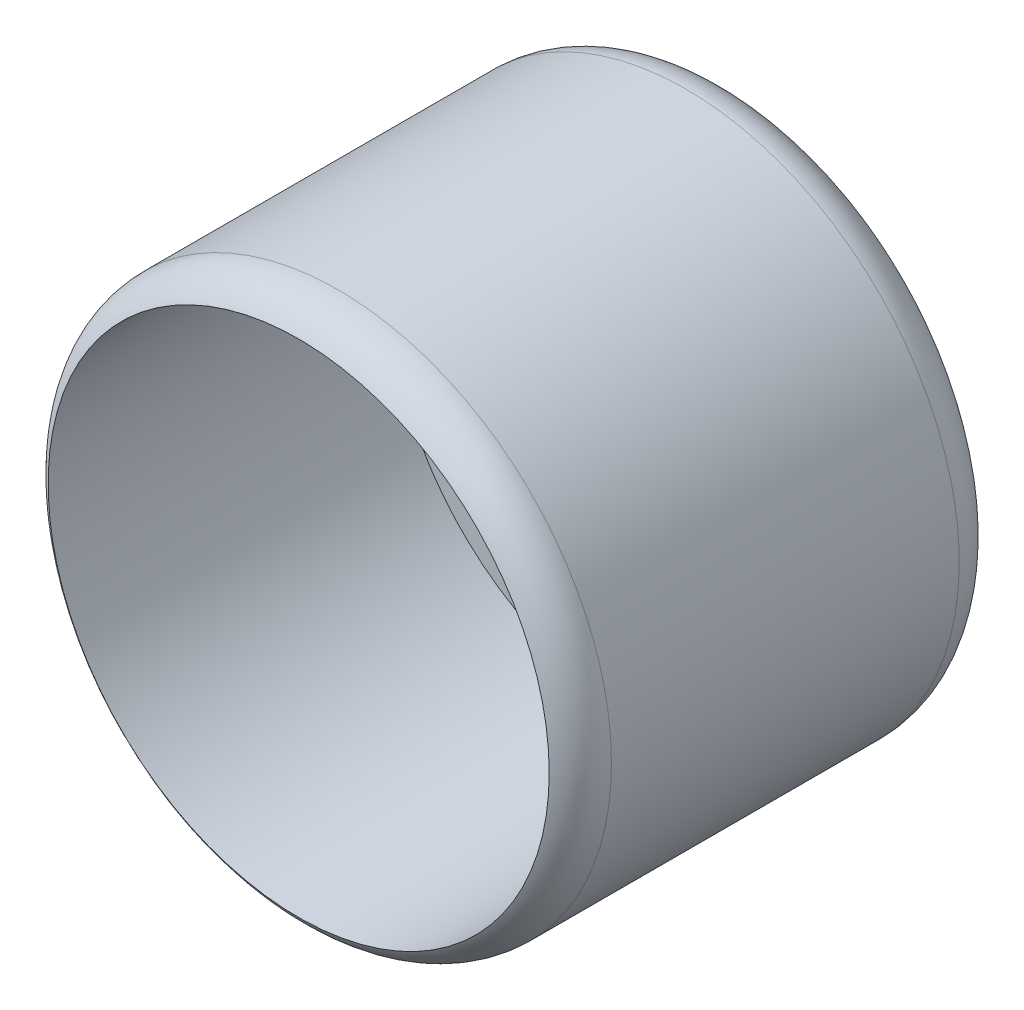
from build123d import *

# Parameters (mm, degrees)
BOSS_EXTRU_1_START      = -50
ESQUISSE1_R             = 60
BOSS_EXTRU_1_DEPTH      = 80
COQUE1_T                = -5
BOSS_EXTRU_2_START      = 15
ESQUISSE2_R             = 60
BOSS_EXTRU_2_DEPTH      = 15
ESQUISSE3_R             = 17.5
ENL_V_MAT_EXTRU_1_DEPTH = 20
ESQUISSE4_R             = 20
ENL_V_MAT_EXTRU_2_DEPTH = 1
CONG_1_R                = 10
CONG_2_R                = 10
ECHELLE1_SCALE          = 0.25


with BuildPart() as part:
    # Esquisse1 → Boss.-Extru.1 (new body)
    with BuildSketch(Plane.XY.offset(BOSS_EXTRU_1_START)):
        Circle(ESQUISSE1_R)
    extrude(amount=BOSS_EXTRU_1_DEPTH)

    # Coque1
    coque1_openings = [part.faces().sort_by_distance(p)[0] for p in [
        (0, 0, 30),
    ]]
    offset(amount=COQUE1_T, openings=coque1_openings, kind=Kind.INTERSECTION)

    # Esquisse2 → Boss.-Extru.2 (add)
    with BuildSketch(Plane(origin=(0, 0, -50), x_dir=(-1, 0, 0), z_dir=(0, 0, -1)).offset(BOSS_EXTRU_2_START)):
        Circle(ESQUISSE2_R)
    extrude(amount=-BOSS_EXTRU_2_DEPTH)

    # Esquisse3 → Enlèv. mat.-Extru.1 (cut)
    with BuildSketch(Plane(origin=(0, 0, -65), x_dir=(-1, 0, 0), z_dir=(0, 0, -1))):
        Circle(ESQUISSE3_R)
    extrude(amount=-ENL_V_MAT_EXTRU_1_DEPTH, mode=Mode.SUBTRACT)

    # Esquisse4 → Enlèv. mat.-Extru.2 (cut)
    with BuildSketch(Plane.XY.offset(-45)):
        Circle(ESQUISSE4_R)
    extrude(amount=-ENL_V_MAT_EXTRU_2_DEPTH, mode=Mode.SUBTRACT)

    # Congé1
    cong_1_edges = [part.edges().sort_by_distance(p)[0] for p in [
        (60, 0, -65),
    ]]
    fillet(cong_1_edges, radius=CONG_1_R)

    # Congé2
    # the kernel refuses this fillet: 10 mm, written as the material it takes off along each edge
    with BuildSketch(Plane(origin=(0, 0, 30), x_dir=(1, 0, 0), z_dir=(0, -1, 0))) as cong_2_piece_1:
        with BuildLine():
            CenterArc((50, -8.660254038), CONG_2_R, 0, 60)
            Line((55, 0), (55.1, 0.173205081))
            ThreePointArc((55.1, 0.173205081), (57.5, 0.2), (60, 0.2))
            Line((60, 0.2), (60.2, 0))
            Line((60.2, 0), (60.2, -8.660254038))
            Line((60.2, -8.660254038), (60, -8.660254038))
        make_face()
    revolve(axis=Axis((0, 0, 30), (0, 0, 1)), mode=Mode.SUBTRACT)


with BuildPart() as part_1:
    # Echelle1: scaled about (0, 0, -36.474067002)
    add(part.part.scale(ECHELLE1_SCALE).moved(Location((0, 0, -27.355550251))))


solid = part_1.part
